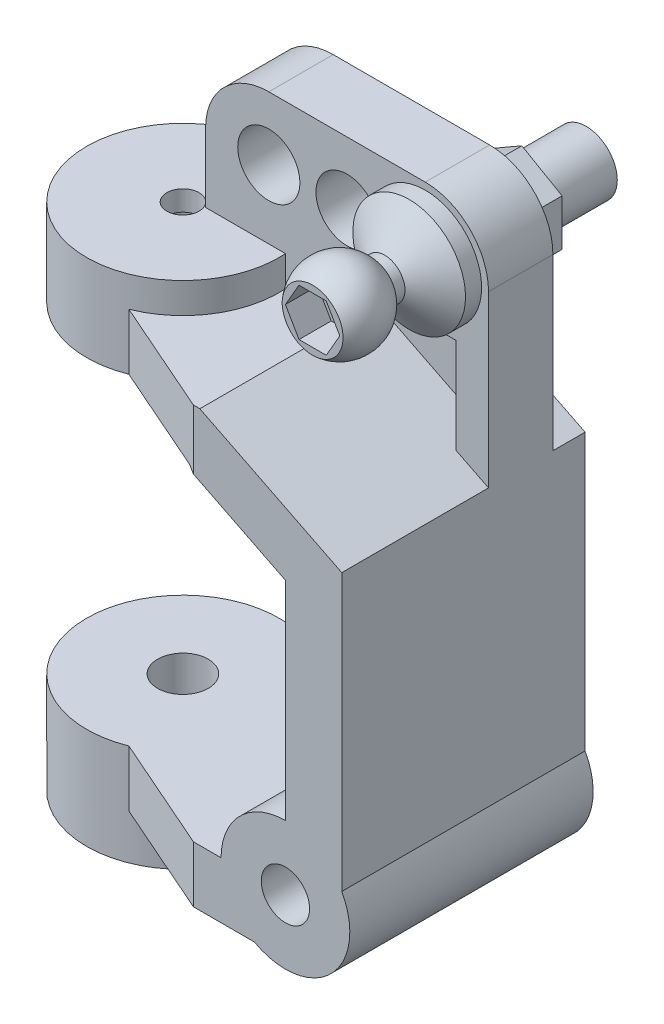
from build123d import *

# Parameters (mm, degrees)
BOSS_EXTRUDE1_DEPTH             = 12
CUT_EXTRUDE1_DEPTH              = 26.760554208
SKETCH4_R                       = 4.75
SKETCH4_R_2                     = 1.25
BOSS_EXTRUDE2_DEPTH             = 1.5
BOSS_EXTRUDE2_DIRECTION_2_REACH = 28.092
BOSS_EXTRUDE3_START             = -5
BOSS_EXTRUDE3_OUTLINE_R         = 1.25
BOSS_EXTRUDE3_DEPTH             = 5
SKETCH6_R                       = 0.95
CUT_EXTRUDE2_DEPTH              = 3
BOSS_EXTRUDE4_START             = -1
SKETCH8_R                       = 1.25
SKETCH8_R_2                     = 0.79375
BOSS_EXTRUDE4_DEPTH             = 1
BOSS_EXTRUDE5_DEPTH             = 0.625
SKETCH11_R                      = 1.532291667
BOSS_EXTRUDE6_DEPTH             = 3.175
CUT_EXTRUDE3_DEPTH              = 1.5875
SKETCH13_R                      = 1.532291667
BOSS_EXTRUDE7_DEPTH             = 1.5875
CUT_EXTRUDE4_DEPTH              = 1.5875


# Read off the part's stored shape, not the designer's step: Boss-Extrude3
with BuildPart() as part:
    # Sketch1 → Boss-Extrude1 (new body)
    with BuildSketch(Plane.XY):
        with BuildLine():
            Line((-1.765801731, 4.94680722), (-7.765801731, 4.94680722))
            Line((-7.765801731, 4.94680722), (-7.765801731, 2.16867722))
            Line((-7.765801731, 2.16867722), (-2.421629262, 2.16867722))
            Line((-2.421629262, 2.16867722), (2.456068269, -0.270171545))
            Line((2.456068269, -0.270171545), (2.456068269, -10.53131278))
            ThreePointArc((2.456068269, -10.53131278), (4.06858061, -10.971275495), (5.234198269, -12.169231551))
            Line((5.234198269, -12.169231551), (5.234198269, 1.44680722))
            Line((5.234198269, 1.44680722), (-1.765801731, 4.94680722))
        make_face()
        with BuildLine():
            Line((5.234198269, -15.243394008), (5.234198269, -12.169231551))
            ThreePointArc((5.234198269, -12.169231551), (4.06858061, -10.971275495), (2.456068269, -10.53131278))
            Line((2.456068269, -10.53131278), (2.456068269, -12.51568778))
            ThreePointArc((2.456068269, -12.51568778), (3.29796728, -12.864413768), (3.646693269, -13.70631278))
            ThreePointArc((3.646693269, -13.70631278), (2.456068269, -14.89693778), (1.265443269, -13.70631278))
            Line((1.265443269, -13.70631278), (-0.718931731, -13.70631278))
            ThreePointArc((-0.718931731, -13.70631278), (-0.278969016, -15.318825121), (0.91898704, -16.48444278))
            Line((0.91898704, -16.48444278), (3.993149497, -16.48444278))
            ThreePointArc((3.993149497, -16.48444278), (4.701132299, -15.95137681), (5.234198269, -15.243394008))
        make_face()
        with BuildLine():
            Line((2.456068269, -12.51568778), (2.456068269, -10.53131278))
            ThreePointArc((2.456068269, -10.53131278), (0.211004238, -11.461248749), (-0.718931731, -13.70631278))
            Line((-0.718931731, -13.70631278), (1.265443269, -13.70631278))
            ThreePointArc((1.265443269, -13.70631278), (1.614169257, -12.864413768), (2.456068269, -12.51568778))
        make_face()
        with BuildLine():
            ThreePointArc((5.631068269, -13.70631278), (5.530250091, -12.91256778), (5.234198269, -12.169231551))
            Line((5.234198269, -12.169231551), (5.234198269, -15.243394008))
            ThreePointArc((5.234198269, -15.243394008), (5.530250091, -14.50005778), (5.631068269, -13.70631278))
        make_face()
        with BuildLine():
            ThreePointArc((0.91898704, -16.48444278), (2.456068269, -16.88131278), (3.993149497, -16.48444278))
            Line((3.993149497, -16.48444278), (0.91898704, -16.48444278))
        make_face()
        with BuildLine():
            ThreePointArc((0.91898704, -16.48444278), (-0.278969016, -15.318825121), (-0.718931731, -13.70631278))
            Line((-0.718931731, -13.70631278), (-7.765801731, -13.70631278))
            Line((-7.765801731, -13.70631278), (-7.765801731, -16.48444278))
            Line((-7.765801731, -16.48444278), (0.91898704, -16.48444278))
        make_face()
    extrude(amount=BOSS_EXTRUDE1_DEPTH)

    # Sketch3 → Cut-Extrude1 (cut, through all)
    with BuildSketch(Plane.XZ.offset(16.48444278)):
        Polygon((-7.765801731, 9.5), (-2.08101296, 12), (-7.765801731, 12), align=None)
    extrude(amount=-CUT_EXTRUDE1_DEPTH, mode=Mode.SUBTRACT)

    # Sketch4 → Boss-Extrude2 (add)
    with BuildSketch(Plane(origin=(0, 4.94680722, 0), x_dir=(1, 0, 0), z_dir=(0, 1, 0))):
        with Locations(Location((-9.515801731, -5.084119567, 0), (0, 0, 180))):
            Circle(SKETCH4_R)
        with Locations(Location((-9.515801731, -5.084119567, 0), (0, 0, 180))):
            Circle(SKETCH4_R_2, mode=Mode.SUBTRACT)
    extrude(amount=BOSS_EXTRUDE2_DEPTH)

    # Boss-Extrude2 direction 2: up to this face of the body (flat: up to its plane)
    boss_extrude2_direction_2_end = Plane(part.part.faces().sort_by_distance((-4.995668733, 2.16867722, 5.359110802))[0])
    # Sketch4 → Boss-Extrude2 direction 2 (add, up to the picked face)
    with BuildSketch(Plane(origin=(0, 4.94680722, 0), x_dir=(1, 0, 0), z_dir=(0, 1, 0)), mode=Mode.PRIVATE) as boss_extrude2_direction_2_sk1:
        with Locations(Location((-9.515801731, -5.084119567, 0), (0, 0, 180))):
            Circle(SKETCH4_R)
        with Locations(Location((-9.515801731, -5.084119567, 0), (0, 0, 180))):
            Circle(SKETCH4_R_2, mode=Mode.SUBTRACT)
    boss_extrude2_direction_2_tool1 = split(extrude(boss_extrude2_direction_2_sk1.sketch, amount=-BOSS_EXTRUDE2_DIRECTION_2_REACH, mode=Mode.PRIVATE), bisect_by=boss_extrude2_direction_2_end, keep=Keep.BOTH, mode=Mode.PRIVATE)
    add(boss_extrude2_direction_2_tool1.solids().sort_by(Axis((-4.900152, 4.946807, 5.08412), (0, -1, 0)))[0])

    # Boss-Extrude3 outline → Boss-Extrude3 (add)
    with BuildSketch(Plane(origin=(0, -13.70631278, 0), x_dir=(1, 0, 0), z_dir=(0, 1, 0)).offset(BOSS_EXTRUDE3_START)):
        with BuildLine():
            ThreePointArc((-5.39824459, -2.715950825), (-14.265801731, -5.084119567), (-5.39824459, -7.452288309))
            Line((-5.39824459, -7.452288309), (-4.405194864, -5.725663462))
            ThreePointArc((-4.405194864, -5.725663462), (-4.233864229, -5.084119567), (-4.405194864, -4.442575672))
            Line((-4.405194864, -4.442575672), (-5.39824459, -2.715950825))
        make_face()
        with Locations((-9.515801731, -5.084119567)):
            Circle(BOSS_EXTRUDE3_OUTLINE_R, mode=Mode.SUBTRACT)
    extrude(amount=BOSS_EXTRUDE3_DEPTH)

    # Sketch6 → Cut-Extrude2 (cut)
    with BuildSketch(Plane.XZ.offset(18.70631278)):
        with Locations(Location((-6.24983298, 5.084119567, 0), (0, 0, 270))):
            Circle(SKETCH6_R)
    extrude(amount=-CUT_EXTRUDE2_DEPTH, mode=Mode.SUBTRACT)

    # Sketch8 → Boss-Extrude4 (add)
    with BuildSketch(Plane(origin=(0, 6.44680722, 0), x_dir=(1, 0, 0), z_dir=(0, 1, 0)).offset(BOSS_EXTRUDE4_START)):
        with Locations(Location((-9.515801731, -5.084119567, 0), (0, 0, 180))):
            Circle(SKETCH8_R)
        with Locations(Location((-9.515801731, -5.084119567, 0), (0, 0, 180))):
            Circle(SKETCH8_R_2, mode=Mode.SUBTRACT)
    extrude(amount=BOSS_EXTRUDE4_DEPTH)

    # Sketch9 → Boss-Extrude5 (add)
    with BuildSketch(Plane(origin=(0, 0, 2.38125), x_dir=(-1, 0, 0), z_dir=(0, 0, -1))):
        Polygon((5.971387176, 2.16867722), (-2.456068269, -2.045050502), (-2.456068269, -0.270171545), (2.421629262, 2.16867722), align=None)
        Polygon((4.642221382, -13.70631278), (-2.456068269, -10.156401543), (-2.456068269, -11.535790724), (0, -13.70631278), align=None)
    extrude(amount=-BOSS_EXTRUDE5_DEPTH)

    # Sketch11 → Boss-Extrude6 (add)
    with BuildSketch(Plane(origin=(0, 0, 1.5875), x_dir=(-1, 0, 0), z_dir=(0, 0, -1))):
        with BuildLine():
            Line((-5.234198269, 1.44680722), (-5.234198269, 9.827015554))
            ThreePointArc((-5.234198269, 9.827015554), (-4.320432445, 12.033041397), (-2.114406602, 12.94680722))
            Line((-2.114406602, 12.94680722), (5.602260065, 12.94680722))
            ThreePointArc((5.602260065, 12.94680722), (7.808285908, 12.033041397), (8.722051731, 9.827015554))
            Line((8.722051731, 9.827015554), (8.722051731, 6.44680722))
            Line((8.722051731, 6.44680722), (8.722051731, 4.94680722))
            Line((8.722051731, 4.94680722), (1.765801731, 4.94680722))
            Line((1.765801731, 4.94680722), (-5.234198269, 1.44680722))
        make_face()
        with Locations((5.602260065, 9.827015554)):
            Circle(SKETCH11_R, mode=Mode.SUBTRACT)
        with Locations((1.743926731, 9.827015554)):
            Circle(SKETCH11_R, mode=Mode.SUBTRACT)
        with Locations((-2.114406602, 9.827015554)):
            Circle(SKETCH11_R, mode=Mode.SUBTRACT)
    extrude(amount=-BOSS_EXTRUDE6_DEPTH)

    # Sketch14 → Cut-Extrude3 (cut)
    with BuildSketch(Plane.XY.offset(4.7625)):
        Polygon((3.634198269, 2.24680722), (3.634198269, 6.94680722), (-2.365801731, 6.94680722), (-2.365801731, 4.94680722), (-1.765801731, 4.94680722), align=None)
    extrude(amount=-CUT_EXTRUDE3_DEPTH, mode=Mode.SUBTRACT)

    # Sketch12 → Revolve1 (revolve)
    with BuildSketch(Plane(origin=(2.114406602, 0, 0), x_dir=(0, 0, -1), z_dir=(1, 0, 0)), mode=Mode.PRIVATE) as revolve1_sk:
        with BuildLine():
            Line((-6.7625, 10.827015554), (-7.2625, 10.827015554))
            ThreePointArc((-7.2625, 10.827015554), (-8.67222129, 11.800758233), (-10.31875, 11.327015554))
            Line((-10.31875, 11.327015554), (-10.31875, 9.827015554))
            Line((-10.31875, 9.827015554), (-1.5875, 9.827015554))
            Line((-1.5875, 9.827015554), (3.175, 9.827015554))
            Line((3.175, 9.827015554), (3.175, 11.35930722))
            Line((3.175, 11.35930722), (-1.5875, 11.35930722))
            Line((-1.5875, 11.35930722), (-4.7625, 11.35930722))
            Line((-4.7625, 11.35930722), (-4.7625, 12.605140554))
            Line((-4.7625, 12.605140554), (-5.55625, 12.605140554))
            Line((-5.55625, 12.605140554), (-6.7625, 10.827015554))
        make_face()
    revolve(revolve1_sk.sketch.rotate(Axis((2.114406602, 9.827015554, 4.7625), (0, 0, -1)), 90), axis=Axis((2.114406602, 9.827015554, 4.7625), (0, 0, -1)))

    # Sketch13 → Boss-Extrude7 (add)
    with BuildSketch(Plane(origin=(0, 0, 1.5875), x_dir=(-1, 0, 0), z_dir=(0, 0, -1))):
        Polygon((-0.130031602, 10.972694994), (-2.114406602, 12.118374435), (-4.098781602, 10.972694994), (-4.098781602, 8.681336113), (-2.114406602, 7.535656673), (-0.130031602, 8.681336113), align=None)
        with Locations(Location((-2.114406602, 9.827015554, 0), (0, 0, 180))):
            Circle(SKETCH13_R, mode=Mode.SUBTRACT)
    extrude(amount=BOSS_EXTRUDE7_DEPTH)

    # Sketch15 → Cut-Extrude4 (cut)
    with BuildSketch(Plane.XY.offset(10.31875)):
        Polygon((3.455328551, 9.827015554), (2.784867577, 10.988288026), (1.443945627, 10.988288026), (0.773484653, 9.827015554), (1.443945627, 8.665743081), (2.784867577, 8.665743081), align=None)
    extrude(amount=-CUT_EXTRUDE4_DEPTH, mode=Mode.SUBTRACT)


solid = part.part
